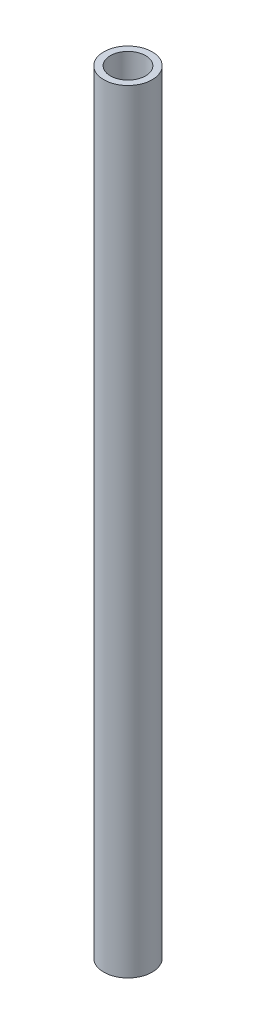
from build123d import *

# Parameters (mm, degrees)
SKETCH1_R           = 16.7005
SKETCH1_R_2         = 12.1539
BOSS_EXTRUDE1_DEPTH = 266.7


with BuildPart() as part:
    # Sketch1 → Boss-Extrude1 (new, symmetric)
    with BuildSketch(Plane(origin=(0, 0, 0), x_dir=(1, 0, 0), z_dir=(0, 1, 0))):
        Circle(SKETCH1_R)
        Circle(SKETCH1_R_2, mode=Mode.SUBTRACT)
    extrude(amount=BOSS_EXTRUDE1_DEPTH, both=True)


solid = part.part
